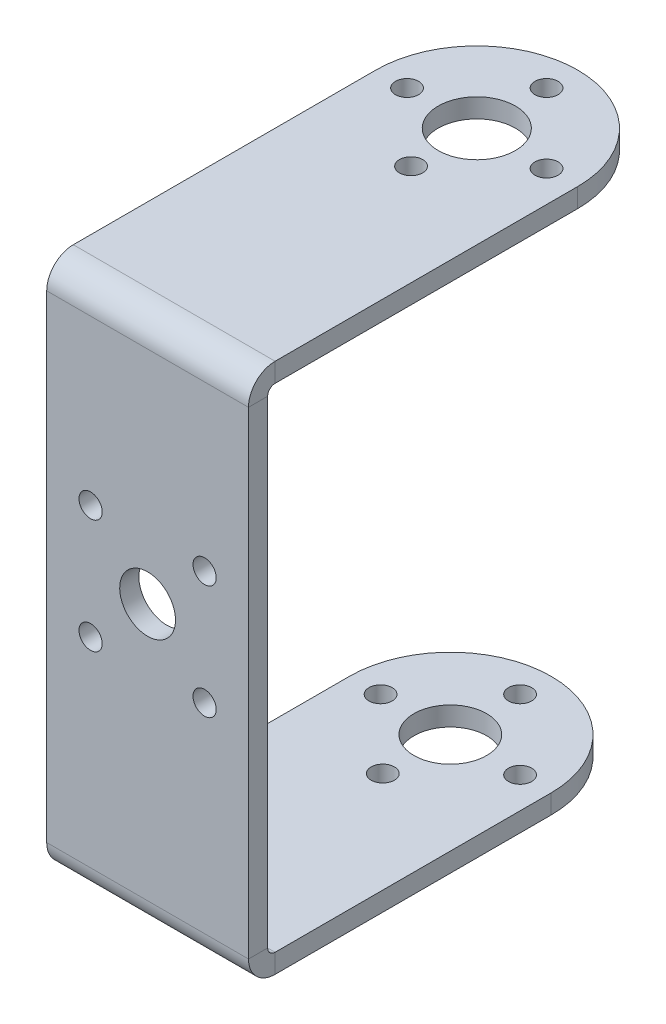
from build123d import *

# Parameters (mm, degrees)
SKETCH2_R                    = 3.600024351
SKETCH2_R_2                  = 3.825
SKETCH2_R_3                  = 1.15
SKETCH2_R_4                  = 2.765
BASE_FLANGE1_DEPTH           = 1.9
SKETCHED_START               = -1.9
SKETCHED_BEND1_OUTLINE_R     = 1.15
SKETCHED_BEND1_OUTLINE_R_2   = 3.825
SKETCHED_BEND1_OUTLINE_R_3   = 2.765
SKETCHED_BEND1_DEPTH         = 1.9
SKETCHED_START_2             = 0.7366
SKETCHED_BEND1_2_OUTLINE_W   = 20
SKETCHED_BEND1_2_OUTLINE_H   = 1.9
SKETCHED_BEND1_2_DEPTH       = 18.665060817
SKETCHED_START_3             = 33.001661017
SKETCHED_BEND1_3_OUTLINE_W   = 20
SKETCHED_BEND1_3_OUTLINE_H   = 1.9
SKETCHED_BEND1_3_DEPTH       = 15.085633898
SKETCHED_START_4             = 21.701661017
SKETCHED_BEND1_4_OUTLINE_W   = 20
SKETCHED_BEND1_4_OUTLINE_H   = 1.9
SKETCHED_BEND1_4_DEPTH       = 1.7349998
SKETCHED_START_5             = 28.966661017
SKETCHED_BEND1_5_OUTLINE_W   = 20
SKETCHED_BEND1_5_OUTLINE_H   = 1.9
SKETCHED_BEND1_5_DEPTH       = 1.7349998
SKETCHED_START_6             = 48.087294915
SKETCHED_BEND1_6_OUTLINE_R   = 1.15
SKETCHED_BEND1_6_OUTLINE_R_2 = 3.825
SKETCHED_BEND1_6_DEPTH       = 2.6366
SKETCHED_BEND1_7_OUTLINE_R   = 1.15
SKETCHED_BEND1_7_OUTLINE_R_2 = 3.825
SKETCHED_BEND1_7_DEPTH       = 0.7366
SKETCHED_START_7             = 19.401660817
SKETCHED_BEND1_8_OUTLINE_W   = 20
SKETCHED_BEND1_8_OUTLINE_H   = 1.9
SKETCHED_BEND1_8_DEPTH       = 13.6000002
SKETCHED_START_8             = -6.58905351
SKETCHED_BEND1_9_OUTLINE_R   = 1.15
SKETCHED_BEND1_9_OUTLINE_R_2 = 2.765
SKETCHED_BEND1_9_DEPTH       = 1.9
SKETCHED_START_9             = -19.822316292
SKETCHED_BEND1_10_DEPTH      = 20


with BuildPart() as part:
    # Base-Flange1: sheet metal written as solids
    # Sketch2 → Base-Flange1 (new body)
    with BuildSketch(Plane(origin=(0, 0, 0), x_dir=(1, 0, 0), z_dir=(0, 1, 0))):
        with BuildLine():
            Line((-19.822316292, 34.68905351), (-19.822316292, -75.31094649))
            ThreePointArc((-19.822316292, -75.31094649), (-9.822316292, -85.31094649), (0.177683708, -75.31094649))
            Line((0.177683708, -75.31094649), (0.177683708, 34.68905351))
            ThreePointArc((0.177683708, 34.68905351), (-9.822316292, 44.68905351), (-19.822316292, 34.68905351))
        make_face()
        with Locations(Location((-9.822316292, 34.68905351, 0), (0, 0, 270))):
            Circle(SKETCH2_R, mode=Mode.SUBTRACT)
        with Locations(Location((-9.822316292, -75.31094649, 0), (0, 0, 270))):
            Circle(SKETCH2_R_2, mode=Mode.SUBTRACT)
        with Locations(Location((-16.734816292, 34.68905351, 0), (0, 0, 270))):
            Circle(SKETCH2_R_3, mode=Mode.SUBTRACT)
        with Locations(Location((-2.909816292, 34.68905351, 0), (0, 0, 270))):
            Circle(SKETCH2_R_3, mode=Mode.SUBTRACT)
        with Locations(Location((-9.822316292, 41.60155351, 0), (0, 0, 270))):
            Circle(SKETCH2_R_3, mode=Mode.SUBTRACT)
        with Locations(Location((-9.822316292, 27.999029159, 0), (0, 0, 270))):
            Circle(SKETCH2_R_3, mode=Mode.SUBTRACT)
        with Locations(Location((-16.734816292, -75.31094649, 0), (0, 0, 270))):
            Circle(SKETCH2_R_3, mode=Mode.SUBTRACT)
        with Locations(Location((-9.822316292, -82.22344649, 0), (0, 0, 270))):
            Circle(SKETCH2_R_3, mode=Mode.SUBTRACT)
        with Locations(Location((-2.909816292, -75.31094649, 0), (0, 0, 270))):
            Circle(SKETCH2_R_3, mode=Mode.SUBTRACT)
        with Locations(Location((-9.822316292, -68.795742607, 0), (0, 0, 270))):
            Circle(SKETCH2_R_3, mode=Mode.SUBTRACT)
        with Locations(Location((-9.822316292, -20.788712491, 0), (0, 0, 270))):
            Circle(SKETCH2_R_4, mode=Mode.SUBTRACT)
        with Locations(Location((-15.472316292, -15.138712491, 0), (0, 0, 270))):
            Circle(SKETCH2_R_3, mode=Mode.SUBTRACT)
        with Locations(Location((-4.172316292, -15.138712491, 0), (0, 0, 270))):
            Circle(SKETCH2_R_3, mode=Mode.SUBTRACT)
        with Locations(Location((-15.472316292, -26.438712491, 0), (0, 0, 270))):
            Circle(SKETCH2_R_3, mode=Mode.SUBTRACT)
        with Locations(Location((-4.172316292, -26.438712491, 0), (0, 0, 270))):
            Circle(SKETCH2_R_3, mode=Mode.SUBTRACT)
    extrude(amount=-BASE_FLANGE1_DEPTH)

    # Sketched Bend1: read off the stored shape, not the designer's step
    # Sketched Bend1 outline → Sketched Bend1 (cut)
    with BuildSketch(Plane(origin=(0, 0, 0), x_dir=(1, 0, 0), z_dir=(0, 1, 0)).offset(SKETCHED_START)):
        with BuildLine():
            Line((0.177683708, -75.31094649), (0.177683708, 4.68905351))
            Line((0.177683708, 4.68905351), (-19.822316292, 4.68905351))
            Line((-19.822316292, 4.68905351), (-19.822316292, -75.31094649))
            ThreePointArc((-19.822316292, -75.31094649), (-9.822316292, -85.31094649), (0.177683708, -75.31094649))
        make_face()
        with Locations((-16.734816292, -75.31094649)):
            Circle(SKETCHED_BEND1_OUTLINE_R, mode=Mode.SUBTRACT)
        with Locations((-15.472316292, -26.438712491)):
            Circle(SKETCHED_BEND1_OUTLINE_R, mode=Mode.SUBTRACT)
        with Locations((-9.822316292, -82.22344649)):
            Circle(SKETCHED_BEND1_OUTLINE_R, mode=Mode.SUBTRACT)
        with Locations((-9.822316292, -75.31094649)):
            Circle(SKETCHED_BEND1_OUTLINE_R_2, mode=Mode.SUBTRACT)
        with Locations((-9.822316292, -68.795742607)):
            Circle(SKETCHED_BEND1_OUTLINE_R, mode=Mode.SUBTRACT)
        with Locations((-2.909816292, -75.31094649)):
            Circle(SKETCHED_BEND1_OUTLINE_R, mode=Mode.SUBTRACT)
        with Locations((-9.822316292, -20.788712491)):
            Circle(SKETCHED_BEND1_OUTLINE_R_3, mode=Mode.SUBTRACT)
        with Locations((-4.172316292, -26.438712491)):
            Circle(SKETCHED_BEND1_OUTLINE_R, mode=Mode.SUBTRACT)
        with Locations((-15.472316292, -15.138712491)):
            Circle(SKETCHED_BEND1_OUTLINE_R, mode=Mode.SUBTRACT)
        with Locations((-4.172316292, -15.138712491)):
            Circle(SKETCHED_BEND1_OUTLINE_R, mode=Mode.SUBTRACT)
    extrude(amount=SKETCHED_BEND1_DEPTH, mode=Mode.SUBTRACT)



with BuildPart() as body_2:
    # Sketched Bend1 2 outline → Sketched Bend1 2 (new body)
    with BuildSketch(Plane(origin=(0, 0, 0), x_dir=(1, 0, 0), z_dir=(0, 1, 0)).offset(SKETCHED_START_2)):
        with Locations((-9.822316292, 5.63905351)):
            Rectangle(SKETCHED_BEND1_2_OUTLINE_W, SKETCHED_BEND1_2_OUTLINE_H)
    extrude(amount=SKETCHED_BEND1_2_DEPTH)


with BuildPart() as body_3:
    # Sketched Bend1 3 outline → Sketched Bend1 3 (new body)
    with BuildSketch(Plane(origin=(0, 0, 0), x_dir=(1, 0, 0), z_dir=(0, 1, 0)).offset(SKETCHED_START_3)):
        with Locations((-9.822316292, 5.63905351)):
            Rectangle(SKETCHED_BEND1_3_OUTLINE_W, SKETCHED_BEND1_3_OUTLINE_H)
    extrude(amount=SKETCHED_BEND1_3_DEPTH)

    # Sketched Bend1 6 outline → Sketched Bend1 6 (add)
    with BuildSketch(Plane(origin=(0, 0, 0), x_dir=(1, 0, 0), z_dir=(0, 1, 0)).offset(SKETCHED_START_6)):
        with BuildLine():
            Line((-19.822316292, 4.68905351), (0.177683708, 4.68905351))
            Line((0.177683708, 4.68905351), (0.177683708, 37.312948425))
            ThreePointArc((0.177683708, 37.312948425), (-9.822316292, 47.312948425), (-19.822316292, 37.312948425))
            Line((-19.822316292, 37.312948425), (-19.822316292, 4.68905351))
        make_face()
        with Locations((-2.909816292, 37.312948425)):
            Circle(SKETCHED_BEND1_6_OUTLINE_R, mode=Mode.SUBTRACT)
        with Locations((-16.734816292, 37.312948425)):
            Circle(SKETCHED_BEND1_6_OUTLINE_R, mode=Mode.SUBTRACT)
        with Locations((-9.822316292, 30.797744542)):
            Circle(SKETCHED_BEND1_6_OUTLINE_R, mode=Mode.SUBTRACT)
        with Locations((-9.822316292, 37.312948425)):
            Circle(SKETCHED_BEND1_6_OUTLINE_R_2, mode=Mode.SUBTRACT)
        with Locations((-9.822316292, 44.225448425)):
            Circle(SKETCHED_BEND1_6_OUTLINE_R, mode=Mode.SUBTRACT)
    extrude(amount=SKETCHED_BEND1_6_DEPTH)


with BuildPart() as body_4:
    # Sketched Bend1 4 outline → Sketched Bend1 4 (new body)
    with BuildSketch(Plane(origin=(0, 0, 0), x_dir=(1, 0, 0), z_dir=(0, 1, 0)).offset(SKETCHED_START_4)):
        with Locations((-9.822316292, 5.63905351)):
            Rectangle(SKETCHED_BEND1_4_OUTLINE_W, SKETCHED_BEND1_4_OUTLINE_H)
    extrude(amount=SKETCHED_BEND1_4_DEPTH)


with BuildPart() as body_5:
    # Sketched Bend1 5 outline → Sketched Bend1 5 (new body)
    with BuildSketch(Plane(origin=(0, 0, 0), x_dir=(1, 0, 0), z_dir=(0, 1, 0)).offset(SKETCHED_START_5)):
        with Locations((-9.822316292, 5.63905351)):
            Rectangle(SKETCHED_BEND1_5_OUTLINE_W, SKETCHED_BEND1_5_OUTLINE_H)
    extrude(amount=SKETCHED_BEND1_5_DEPTH)


with BuildPart() as part_1:
    add(part.part)

    add(body_2.part)  # Sketched Bend1 7 merges body 2
    # Sketched Bend1 7 outline → Sketched Bend1 7 (add)
    with BuildSketch(Plane(origin=(0, 0, 0), x_dir=(1, 0, 0), z_dir=(0, 1, 0))):
        with BuildLine():
            Line((-19.822316292, 4.68905351), (0.177683708, 4.68905351))
            Line((0.177683708, 4.68905351), (0.177683708, 37.312948425))
            ThreePointArc((0.177683708, 37.312948425), (-9.822316292, 47.312948425), (-19.822316292, 37.312948425))
            Line((-19.822316292, 37.312948425), (-19.822316292, 4.68905351))
        make_face()
        with Locations((-2.909816292, 37.312948425)):
            Circle(SKETCHED_BEND1_7_OUTLINE_R, mode=Mode.SUBTRACT)
        with Locations((-16.734816292, 37.312948425)):
            Circle(SKETCHED_BEND1_7_OUTLINE_R, mode=Mode.SUBTRACT)
        with Locations((-9.822316292, 30.797744542)):
            Circle(SKETCHED_BEND1_7_OUTLINE_R, mode=Mode.SUBTRACT)
        with Locations((-9.822316292, 37.312948425)):
            Circle(SKETCHED_BEND1_7_OUTLINE_R_2, mode=Mode.SUBTRACT)
        with Locations((-9.822316292, 44.225448425)):
            Circle(SKETCHED_BEND1_7_OUTLINE_R, mode=Mode.SUBTRACT)
    extrude(amount=SKETCHED_BEND1_7_DEPTH)


    add(body_3.part)  # Sketched Bend1 8 merges body 3

    add(body_4.part)  # Sketched Bend1 8 merges body 4

    add(body_5.part)  # Sketched Bend1 8 merges body 5
    # Sketched Bend1 8 outline → Sketched Bend1 8 (add)
    with BuildSketch(Plane(origin=(0, 0, 0), x_dir=(1, 0, 0), z_dir=(0, 1, 0)).offset(SKETCHED_START_7)):
        with Locations((-9.822316292, 5.63905351)):
            Rectangle(SKETCHED_BEND1_8_OUTLINE_W, SKETCHED_BEND1_8_OUTLINE_H)
    extrude(amount=SKETCHED_BEND1_8_DEPTH)

    # Sketched Bend1 9 outline → Sketched Bend1 9 (cut)
    with BuildSketch(Plane.XY.offset(SKETCHED_START_8)):
        with Locations((-15.472316292, 20.551660917)):
            Circle(SKETCHED_BEND1_9_OUTLINE_R)
        with Locations((-9.822316292, 26.201660917)):
            Circle(SKETCHED_BEND1_9_OUTLINE_R_2)
        with Locations((-15.472316292, 31.851660917)):
            Circle(SKETCHED_BEND1_9_OUTLINE_R)
        with Locations((-4.172316292, 20.551660917)):
            Circle(SKETCHED_BEND1_9_OUTLINE_R)
        with Locations((-4.172316292, 31.851660917)):
            Circle(SKETCHED_BEND1_9_OUTLINE_R)
    extrude(amount=SKETCHED_BEND1_9_DEPTH, mode=Mode.SUBTRACT)

    # Sketched Bend1 10 outline → Sketched Bend1 10 (cut)
    with BuildSketch(Plane.YZ.offset(SKETCHED_START_9)):
        with BuildLine():
            Line((0, -7.32565351), (0, -49))
            Line((0, -49), (0.7366, -49))
            Line((0.7366, -49), (0.7366, -6.58905351))
            ThreePointArc((0.7366, -6.58905351), (0.215745145, -6.804798655), (0, -7.32565351))
        make_face()
        with BuildLine():
            Line((-3, -49), (-1.900000015, -49))
            Line((-1.900000015, -49), (-1.9, -7.32565351))
            ThreePointArc((-1.9, -7.32565351), (-1.127757739, -5.461295771), (0.7366, -4.68905351))
            Line((0.7366, -4.68905351), (-1.9, -4.68905351))
            Line((-1.9, -4.68905351), (-3, -4.689053525))
            Line((-3, -4.689053525), (-3, -49))
        make_face()
        with BuildLine():
            Line((48.087294915, -6.58905351), (48.087294915, -49))
            Line((48.087294915, -49), (48.823894915, -49))
            Line((48.823894915, -49), (48.823894915, -7.32565351))
            ThreePointArc((48.823894915, -7.32565351), (48.60814977, -6.804798655), (48.087294915, -6.58905351))
        make_face()
        with BuildLine():
            Line((50.723894915, -7.32565351), (50.723894903, -49))
            Line((50.723894903, -49), (52, -49))
            Line((52, -49), (52, -4.689053501))
            Line((52, -4.689053501), (50.723894915, -4.689053492))
            Line((50.723894915, -4.689053492), (48.087294915, -4.68905351))
            ThreePointArc((48.087294915, -4.68905351), (49.951652655, -5.461295771), (50.723894915, -7.32565351))
        make_face()
    extrude(amount=SKETCHED_BEND1_10_DEPTH, mode=Mode.SUBTRACT)


solid = part_1.part
